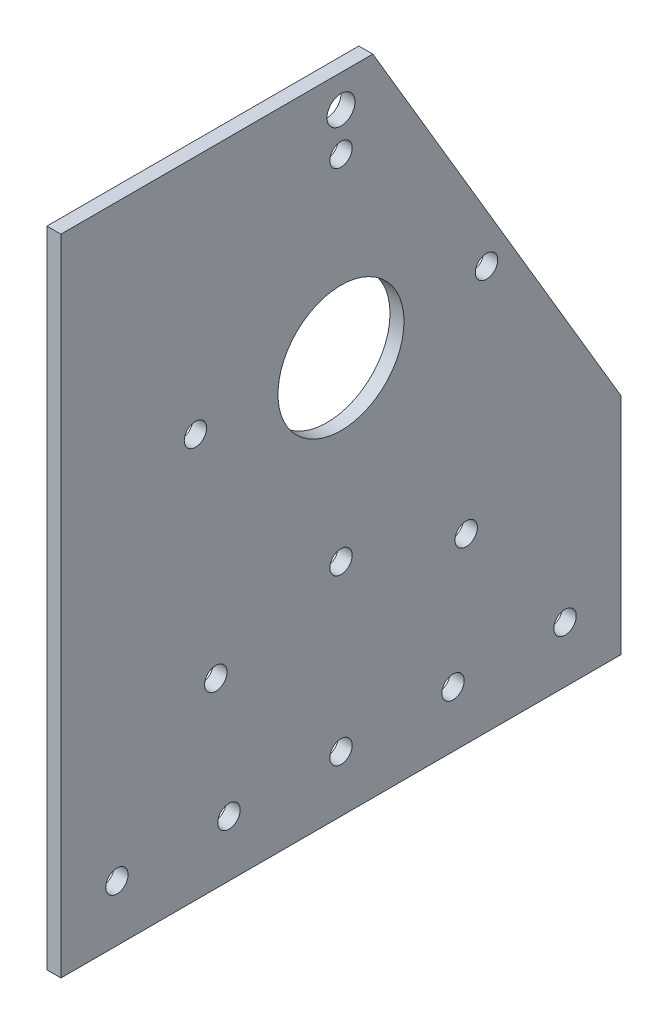
from build123d import *

# Parameters (mm, degrees)
SKETCH1_W          = 127
SKETCH1_H          = 190.5
BASE_FLANGE1_DEPTH = 3.175
SKETCH7_R          = 2.54
SKETCH7_R_2        = 3.175
SKETCH7_R_3        = 14.2875
CUT_EXTRUDE1_DEPTH = 3.175
SKETCH10_R         = 2.54
CUT_EXTRUDE2_DEPTH = 115.52027386
CUT_EXTRUDE3_DEPTH = 115.52027386
CUT_EXTRUDE4_DEPTH = 115.52027386
SKETCH13_R         = 2.54
CUT_EXTRUDE5_DEPTH = 115.52027386


# Sheet-metal steps are written as plain solids
with BuildPart() as part:
    # Sketch1 → Base-Flange1 (new body)
    with BuildSketch(Plane(origin=(0, 0, 0), x_dir=(0, 0, -1), z_dir=(1, 0, 0))):
        Rectangle(SKETCH1_W, SKETCH1_H)
    extrude(amount=-BASE_FLANGE1_DEPTH)

    # Sketch7 → Cut-Extrude1 (cut)
    with BuildSketch(Plane(origin=(0, 0, 0), x_dir=(0, 0, -1), z_dir=(1, 0, 0))):
        with Locations((-28.380000009, -53.975)):
            Circle(SKETCH7_R)
        with Locations((28.380000009, -53.975)):
            Circle(SKETCH7_R)
        with Locations((0, 43.476657776)):
            Circle(SKETCH7_R_2)
        with Locations((0, -5.249171112)):
            Circle(SKETCH7_R_3)
    extrude(amount=-CUT_EXTRUDE1_DEPTH, mode=Mode.SUBTRACT)

    # Sketch10 → Cut-Extrude2 (cut, through all)
    with BuildSketch(Plane.ZY.offset(3.175)):
        with Locations((0, 34.740957442)):
            Circle(SKETCH10_R)
        with Locations((33.00000004, -3.749171064)):
            Circle(SKETCH10_R)
        with Locations((-33.00000004, -3.749171064)):
            Circle(SKETCH10_R)
        with Locations(Location((0, -45.239299666, 0), (0, 0, 180))):
            Circle(SKETCH10_R)
    extrude(amount=-CUT_EXTRUDE2_DEPTH, mode=Mode.SUBTRACT)

    # Sketch11 → Cut-Extrude3 (cut, through all)
    with BuildSketch(Plane.ZY.offset(3.175)):
        Polygon((-63.5, 95.25), (-63.5, -44.45), (19.05, 95.25), align=None)
    extrude(amount=-CUT_EXTRUDE3_DEPTH, mode=Mode.SUBTRACT)

    # Sketch12 → Cut-Extrude4 (cut, through all)
    with BuildSketch(Plane.ZY.offset(3.175)):
        Polygon((63.5, 50.8), (-7.215909091, 50.8), (19.05, 95.25), (63.5, 95.25), align=None)
    extrude(amount=-CUT_EXTRUDE4_DEPTH, mode=Mode.SUBTRACT)

    # Sketch13 → Cut-Extrude5 (cut, through all)
    with BuildSketch(Plane.ZY.offset(3.175)):
        with Locations((-50.8, -82.55)):
            Circle(SKETCH13_R)
        with Locations((0, -82.55)):
            Circle(SKETCH13_R)
        with Locations((50.8, -82.55)):
            Circle(SKETCH13_R)
        with Locations((-25.4, -82.55)):
            Circle(SKETCH13_R)
        with Locations((25.4, -82.55)):
            Circle(SKETCH13_R)
    extrude(amount=-CUT_EXTRUDE5_DEPTH, mode=Mode.SUBTRACT)


solid = part.part
